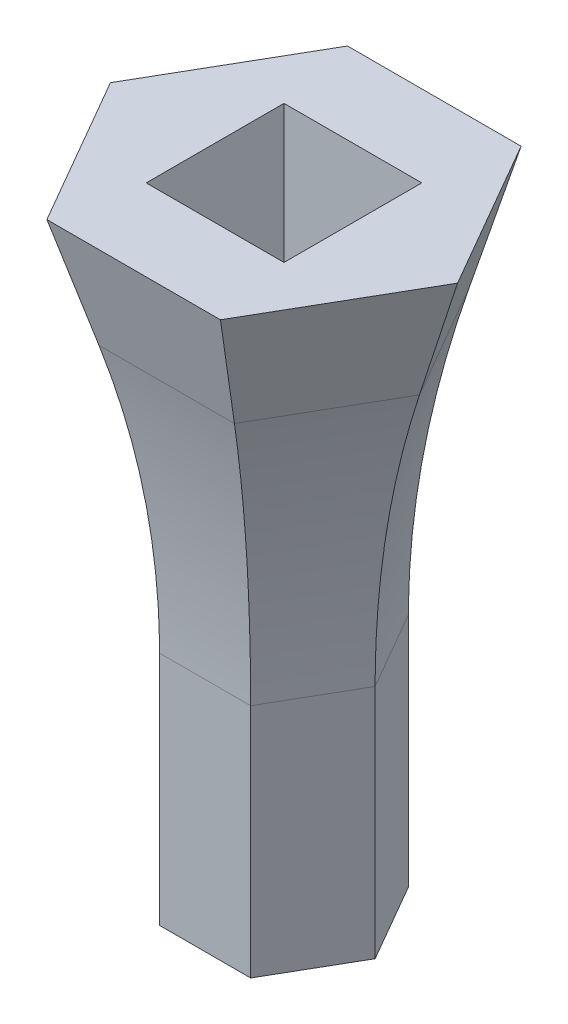
from build123d import *

# Parameters (mm, degrees)
BOSS_EXTRU_1_DEPTH      = 15
ESQUISSE4_W             = 5.5
ESQUISSE4_H             = 5.5
ENL_V_MAT_EXTRU_1_DEPTH = 6
CONG_2_R                = 40


with BuildPart() as part:
    # Esquisse1 → Boss.-Extru.1 (new body)
    with BuildSketch(Plane(origin=(0, 0, 0), x_dir=(1, 0, 0), z_dir=(0, 1, 0))):
        Polygon((1.818653348, -3.15), (3.637306696, 0), (1.818653348, 3.15), (-1.818653348, 3.15), (-3.637306696, 0), (-1.818653348, -3.15), align=None)
    extrude(amount=BOSS_EXTRU_1_DEPTH)

    # Esquisse3 → section 1 of lissage1
    with BuildSketch(Plane(origin=(0, 25, 0), x_dir=(1, 0, 0), z_dir=(0, 1, 0)), mode=Mode.PRIVATE) as lissage1_s1:
        with BuildLine():
            Line((3.464101615, -6), (6.92820323, 0))
            Line((6.92820323, 0), (3.464101615, 6))
            Line((3.464101615, 6), (-3.464101615, 6))
            Line((-3.464101615, 6), (-6.92820323, 0))
            Line((-6.92820323, 0), (-3.464101615, -6))
            Line((-3.464101615, -6), (3.464101615, -6))
        make_face()
    # loft from a face of the part (lissage1)
    loft([part.faces().sort_by_distance((0, 15, 0))[0], lissage1_s1.sketch])

    # Esquisse4 → Enlèv. mat.-Extru.1 (cut)
    with BuildSketch(Plane(origin=(0, 25, 0), x_dir=(1, 0, 0), z_dir=(0, 1, 0))):
        Rectangle(ESQUISSE4_W, ESQUISSE4_H)
    extrude(amount=-ENL_V_MAT_EXTRU_1_DEPTH, mode=Mode.SUBTRACT)

    # Congé2
    # the kernel refuses this fillet: 40 mm, written as the material it adds along each edge
    with BuildSketch(Plane(origin=(-15.790476474, 15, 3.15), x_dir=(0, -1, 0), z_dir=(1, 0, 0))) as cong_2_piece_1_section:
        with BuildLine():
            CenterArc((CONG_2_R * 0.139718231259, -CONG_2_R), CONG_2_R, 90, 15.907551931)
            Line((-CONG_2_R * 0.134367748379, -CONG_2_R * 0.0382948082879), (0, 0))
            Line((0, 0), (CONG_2_R * 0.139718231259, 0))
        make_face()
    cong_2_piece_1 = extrude(amount=31.580952948, mode=Mode.PRIVATE)
    cong_2_piece_1 = cong_2_piece_1 - Plane(origin=(-39.952625281, 9.41127075, 17.100023118), x_dir=(0.8660254037844387, 0, -0.5000000000000001), z_dir=(-0.5000000000000001, 0, -0.8660254037844387)) * Cylinder(40, 86, mode=Mode.PRIVATE)
    cong_2_piece_1 = cong_2_piece_1 - Plane(origin=(32.057387044, 9.41127075, 30.774976882), x_dir=(-0.8660254037844385, 0, -0.5000000000000003), z_dir=(-0.5000000000000003, 0, 0.8660254037844385)) * Cylinder(40, 86, mode=Mode.PRIVATE)
    add(cong_2_piece_1)
    with BuildSketch(Plane(origin=(-5.167258215, 15, 15.249953764), x_dir=(0, -1, 0), z_dir=(0.5000000000000003, 0, -0.8660254037844385))) as cong_2_piece_2_section:
        with BuildLine():
            CenterArc((CONG_2_R * 0.139718231259, -CONG_2_R), CONG_2_R, 90, 15.907551931)
            Line((-CONG_2_R * 0.134367748379, -CONG_2_R * 0.0382948082879), (0, 0))
            Line((0, 0), (CONG_2_R * 0.139718231259, 0))
        make_face()
    cong_2_piece_2 = extrude(amount=31.580952948, mode=Mode.PRIVATE)
    cong_2_piece_2 = cong_2_piece_2 - Plane(origin=(42.680605303, 9.41127075, -12.375023118), x_dir=(-0.8660254037844388, 0, 0.4999999999999999), z_dir=(0.4999999999999999, 0, 0.8660254037844388)) * Cylinder(40, 86, mode=Mode.PRIVATE)
    cong_2_piece_2 = cong_2_piece_2 - Plane(origin=(-5.167258215, 9.41127075, 43.15), x_dir=(0, 0, -1), z_dir=(-1, 0, 0)) * Cylinder(40, 86, mode=Mode.PRIVATE)
    add(cong_2_piece_2)
    with BuildSketch(Plane(origin=(10.623218259, 15, 12.099953764), x_dir=(0, -1, 0), z_dir=(-0.49999999999999994, 0, -0.8660254037844388))) as cong_2_piece_3_section:
        with BuildLine():
            CenterArc((CONG_2_R * 0.139718231259, -CONG_2_R), CONG_2_R, 90, 15.907551931)
            Line((-CONG_2_R * 0.134367748379, -CONG_2_R * 0.0382948082879), (0, 0))
            Line((0, 0), (CONG_2_R * 0.139718231259, 0))
        make_face()
    cong_2_piece_3 = extrude(amount=31.580952948, mode=Mode.PRIVATE)
    cong_2_piece_3 = cong_2_piece_3 - Plane(origin=(34.785367066, 9.41127075, 26.049976882), x_dir=(-0.8660254037844385, 0, -0.5000000000000003), z_dir=(-0.5000000000000003, 0, 0.8660254037844385)) * Cylinder(40, 86, mode=Mode.PRIVATE)
    cong_2_piece_3 = cong_2_piece_3 - Plane(origin=(10.623218259, 9.41127075, -43.15), x_dir=(0, 0, 1), z_dir=(1, 0, 0)) * Cylinder(40, 86, mode=Mode.PRIVATE)
    add(cong_2_piece_3)
    with BuildSketch(Plane(origin=(15.790476474, 15, -3.15), x_dir=(0, -1, 0), z_dir=(-1, 0, 0))) as cong_2_piece_4_section:
        with BuildLine():
            CenterArc((CONG_2_R * 0.139718231259, -CONG_2_R), CONG_2_R, 90, 15.907551931)
            Line((-CONG_2_R * 0.134367748379, -CONG_2_R * 0.0382948082879), (0, 0))
            Line((0, 0), (CONG_2_R * 0.139718231259, 0))
        make_face()
    cong_2_piece_4 = extrude(amount=31.580952948, mode=Mode.PRIVATE)
    cong_2_piece_4 = cong_2_piece_4 - Plane(origin=(-32.057387044, 9.41127075, -30.774976882), x_dir=(0.8660254037844385, 0, 0.5000000000000002), z_dir=(0.5000000000000003, 0, -0.8660254037844386)) * Cylinder(40, 86, mode=Mode.PRIVATE)
    cong_2_piece_4 = cong_2_piece_4 - Plane(origin=(39.952625281, 9.41127075, -17.100023118), x_dir=(-0.8660254037844388, 0, 0.4999999999999999), z_dir=(0.4999999999999999, 0, 0.8660254037844388)) * Cylinder(40, 86, mode=Mode.PRIVATE)
    add(cong_2_piece_4)
    with BuildSketch(Plane(origin=(5.167258215, 15, -15.249953764), x_dir=(0, -1, 0), z_dir=(-0.5000000000000003, 0, 0.8660254037844386))) as cong_2_piece_5_section:
        with BuildLine():
            CenterArc((CONG_2_R * 0.139718231259, -CONG_2_R), CONG_2_R, 90, 15.907551931)
            Line((-CONG_2_R * 0.134367748379, -CONG_2_R * 0.0382948082879), (0, 0))
            Line((0, 0), (CONG_2_R * 0.139718231259, 0))
        make_face()
    cong_2_piece_5 = extrude(amount=31.580952948, mode=Mode.PRIVATE)
    cong_2_piece_5 = cong_2_piece_5 - Plane(origin=(-42.680605303, 9.41127075, 12.375023118), x_dir=(0.8660254037844387, 0, -0.5000000000000001), z_dir=(-0.5000000000000001, 0, -0.8660254037844387)) * Cylinder(40, 86, mode=Mode.PRIVATE)
    cong_2_piece_5 = cong_2_piece_5 - Plane(origin=(5.167258215, 9.41127075, -43.15), x_dir=(0, 0, 1), z_dir=(1, 0, 0)) * Cylinder(40, 86, mode=Mode.PRIVATE)
    add(cong_2_piece_5)
    with BuildSketch(Plane(origin=(-10.623218259, 15, -12.099953764), x_dir=(0, -1, 0), z_dir=(0.5000000000000001, 0, 0.8660254037844387))) as cong_2_piece_6_section:
        with BuildLine():
            CenterArc((CONG_2_R * 0.139718231259, -CONG_2_R), CONG_2_R, 90, 15.907551931)
            Line((-CONG_2_R * 0.134367748379, -CONG_2_R * 0.0382948082879), (0, 0))
            Line((0, 0), (CONG_2_R * 0.139718231259, 0))
        make_face()
    cong_2_piece_6 = extrude(amount=31.580952948, mode=Mode.PRIVATE)
    cong_2_piece_6 = cong_2_piece_6 - Plane(origin=(-34.785367066, 9.41127075, -26.049976882), x_dir=(0.8660254037844385, 0, 0.5000000000000002), z_dir=(0.5000000000000003, 0, -0.8660254037844386)) * Cylinder(40, 86, mode=Mode.PRIVATE)
    cong_2_piece_6 = cong_2_piece_6 - Plane(origin=(-10.623218259, 9.41127075, 43.15), x_dir=(0, 0, -1), z_dir=(-1, 0, 0)) * Cylinder(40, 86, mode=Mode.PRIVATE)
    add(cong_2_piece_6)


solid = part.part
